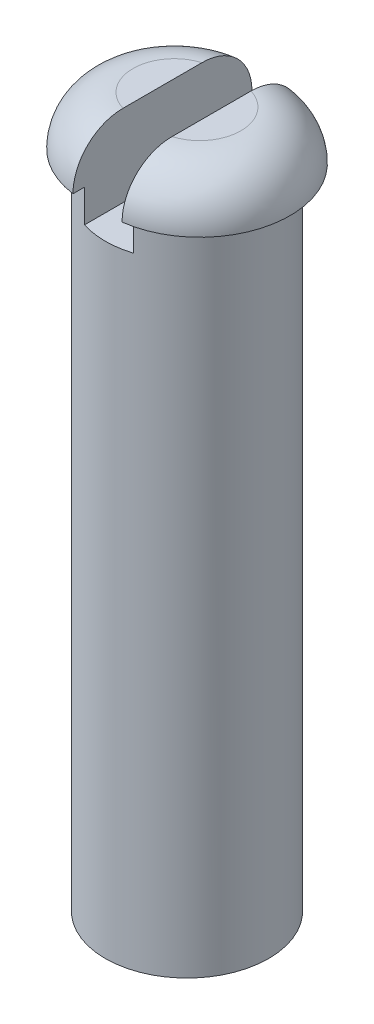
from build123d import *

# Parameters (mm, degrees)
BOSS_EXTRUDE1_START     = -40
BOSS_EXTRUDE1_OUTLINE_R = 5
BOSS_EXTRUDE1_DEPTH     = 40
CUT_EXTRUDE1_DEPTH      = 2
BOSS_EXTRUDE2_DEPTH     = 3
FILLET1_R               = 3


# Read off the part's stored shape, not the designer's step: Boss-Extrude1
with BuildPart() as part:
    # Boss-Extrude1 outline → Boss-Extrude1 (new body)
    with BuildSketch(Plane.XZ.offset(-110).offset(BOSS_EXTRUDE1_START)):
        Circle(BOSS_EXTRUDE1_OUTLINE_R)
    extrude(amount=BOSS_EXTRUDE1_DEPTH)

    # Sketch12 → Cut-Extrude1 (cut)
    with BuildSketch(Plane(origin=(0, 150, 0), x_dir=(1, 0, 0), z_dir=(0, 1, 0))):
        with BuildLine():
            Line((1.5, -4.769696007), (1.5, 4.769696007))
            ThreePointArc((1.5, 4.769696007), (0, 5), (-1.5, 4.769696007))
            Line((-1.5, 4.769696007), (-1.5, -4.769696007))
            ThreePointArc((-1.5, -4.769696007), (0, -5), (1.5, -4.769696007))
        make_face()
    extrude(amount=-CUT_EXTRUDE1_DEPTH, mode=Mode.SUBTRACT)

    # Sketch13 → Boss-Extrude2 (add)
    with BuildSketch(Plane(origin=(0, 150, 0), x_dir=(1, 0, 0), z_dir=(0, 1, 0))):
        with BuildLine():
            Line((1.5, 5.473173211), (1.5, -5.473173211))
            ThreePointArc((1.5, -5.473173211), (6.3, 0), (1.5, 5.473173211))
        make_face()
        with BuildLine():
            Line((-1.5, 5.473173211), (-1.5, -5.473173211))
            ThreePointArc((-1.5, -5.473173211), (-6.3, 0), (-1.5, 5.473173211))
        make_face()
    extrude(amount=BOSS_EXTRUDE2_DEPTH)

    # Fillet1
    fillet1_edges = [part.edges().sort_by_distance(p)[0] for p in [
        (-6.3, 153, 0),
        (6.3, 153, 0),
    ]]
    fillet(fillet1_edges, radius=FILLET1_R - 0.0001)  # a hair under: the kernel refuses the full size


solid = part.part
